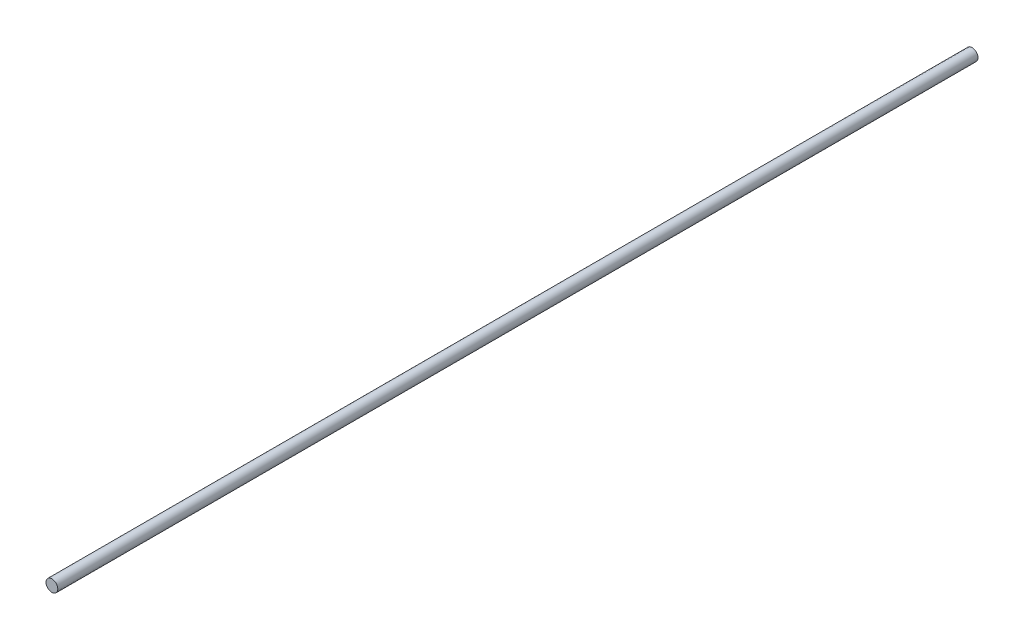
from build123d import *

# Parameters (mm, degrees)
SKETCH1_R           = 1.5875
BOSS_EXTRUDE1_DEPTH = 247.65


with BuildPart() as part:
    # Sketch1 → Boss-Extrude1 (new body)
    with BuildSketch(Plane.XY):
        with Locations((-6.805261823, 9.036985392)):
            Circle(SKETCH1_R)
    extrude(amount=BOSS_EXTRUDE1_DEPTH)


solid = part.part
